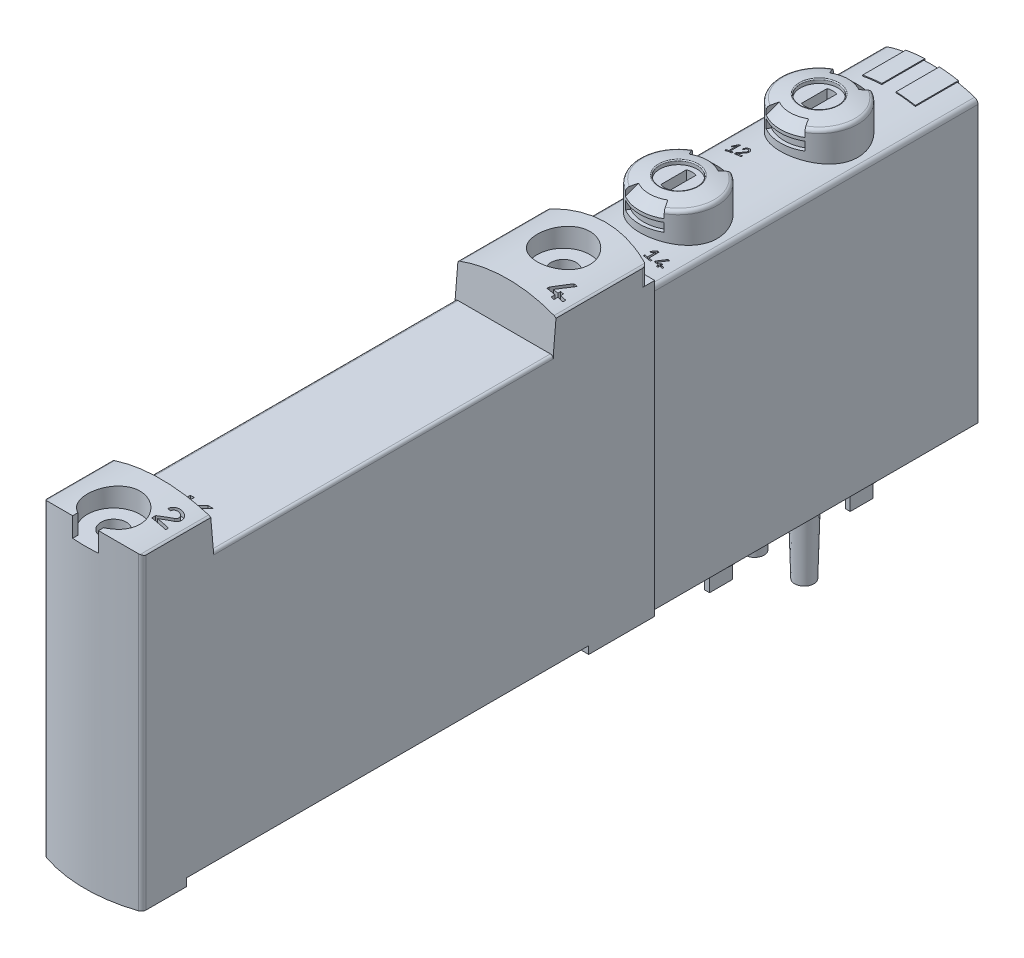
from build123d import *

# Parameters (mm, degrees)
BOSS_EXTRUDE1_DEPTH          = 34
CUT_EXTRUDE1_DEPTH           = 6
CUT_EXTRUDE1_DEPTH_BACK      = 6
SKETCH2_W                    = 34.1
SKETCH2_H                    = 0.4
CUT_EXTRUDE2_DEPTH           = 1.9
CUT_EXTRUDE3_DEPTH           = 1.9
SKETCH9_W                    = 0.5
SKETCH9_H                    = 2.4
BOSS_EXTRUDE2_DEPTH          = 2.5
SKETCH10_W                   = 0.5
SKETCH10_H                   = 2.4
BOSS_EXTRUDE3_DEPTH          = 2.5
SKETCH11_W                   = 0.5
SKETCH11_H                   = 2.4
BOSS_EXTRUDE4_DEPTH          = 2.5
SKETCH12_W                   = 0.5
SKETCH12_H                   = 2.4
BOSS_EXTRUDE5_DEPTH          = 2.5
CUT_REVOLVE1_ANGLE           = 30
CUT_REVOLVE1_OTHER_WAY_ANGLE = 30
CUT_REVOLVE2_ANGLE           = 30
CUT_REVOLVE2_OTHER_WAY_ANGLE = 30
CUT_EXTRUDE4_DEPTH           = 1.7
CUT_REVOLVE3_ANGLE           = 30
CUT_REVOLVE3_OTHER_WAY_ANGLE = 30
CUT_REVOLVE4_ANGLE           = 30
CUT_REVOLVE4_OTHER_WAY_ANGLE = 30
CUT_EXTRUDE5_DEPTH           = 1.7
BOSS_EXTRUDE6_DEPTH          = 4.5
BOSS_EXTRUDE7_DEPTH          = 4.5
BOSS_EXTRUDE8_DEPTH          = 33.1
CUT_EXTRUDE6_DEPTH           = 10
CUT_EXTRUDE6_DEPTH_BACK      = 10
CUT_EXTRUDE7_DEPTH           = 10
CUT_EXTRUDE8_DEPTH           = 10
CUT_EXTRUDE8_DEPTH_BACK      = 10
SKETCH26_W                   = 42
SKETCH26_H                   = 1
CUT_EXTRUDE9_DEPTH           = 55
CUT_EXTRUDE10_DEPTH          = 35.5
CUT_EXTRUDE11_DEPTH          = 2.1
CUT_EXTRUDE11_DEPTH_BACK     = 2.1
SKETCH30_W                   = 1.325
SKETCH30_H                   = 31
CUT_EXTRUDE12_DEPTH          = 3.5
CUT_EXTRUDE12_DEPTH_BACK     = 3.5
CUT_EXTRUDE13_DEPTH          = 3.5
CUT_EXTRUDE13_DEPTH_BACK     = 3.5
CUT_EXTRUDE14_DEPTH          = 3.5
CUT_EXTRUDE14_DEPTH_BACK     = 3.5
CUT_EXTRUDE15_DEPTH          = 3.5
CUT_EXTRUDE15_DEPTH_BACK     = 3.5
CUT_EXTRUDE16_DEPTH          = 1
CUT_EXTRUDE16_DEPTH_BACK     = 1
CUT_EXTRUDE17_DEPTH          = 1
CUT_EXTRUDE17_DEPTH_BACK     = 1
CUT_EXTRUDE18_DEPTH          = 4.5
CUT_EXTRUDE18_DEPTH_BACK     = 4.5


with BuildPart() as part:
    # Sketch1 → Boss-Extrude1 (new body)
    with BuildSketch(Plane.XY.offset(-23.2)):
        with BuildLine():
            Line((-4.9, 29.216294728), (-4.9, 0))
            Line((-4.9, 0), (4.9, 0))
            Line((4.9, 0), (4.9, 29.216294728))
            ThreePointArc((4.9, 29.216294728), (4.803647166, 29.511369236), (4.551724138, 29.692718684))
            ThreePointArc((4.551724138, 29.692718684), (0, 30.4), (-4.551724138, 29.692718684))
            ThreePointArc((-4.551724138, 29.692718684), (-4.803647166, 29.511369236), (-4.9, 29.216294728))
        make_face()
    extrude(amount=BOSS_EXTRUDE1_DEPTH)

    # Sketch2 → Cut-Extrude1 (cut, two sides: drawn at the far end of the back side and taken through both)
    with BuildSketch(Plane(origin=(0, 0, 0), x_dir=(0, 0, -1), z_dir=(1, 0, 0)).offset(-CUT_EXTRUDE1_DEPTH_BACK)):
        with Locations((6.17, 0.2)):
            Rectangle(SKETCH2_W, SKETCH2_H)
    extrude(amount=CUT_EXTRUDE1_DEPTH + CUT_EXTRUDE1_DEPTH_BACK, mode=Mode.SUBTRACT)

    # Sketch3 → Cut-Extrude2 (cut)
    with BuildSketch(Plane(origin=(0, 0, 0), x_dir=(1, 0, 0), z_dir=(0, 1, 0))):
        with BuildLine():
            Line((-3.15, 2.465258607), (-3.15, -2.465258607))
            ThreePointArc((-3.15, -2.465258607), (0, -4), (3.15, -2.465258607))
            Line((3.15, -2.465258607), (3.15, 2.465258607))
            ThreePointArc((3.15, 2.465258607), (0, 4), (-3.15, 2.465258607))
        make_face()
    extrude(amount=CUT_EXTRUDE2_DEPTH, mode=Mode.SUBTRACT)

    # Sketch4 → Cut-Extrude3 (cut)
    with BuildSketch(Plane(origin=(0, 0, 0), x_dir=(1, 0, 0), z_dir=(0, 1, 0))):
        with BuildLine():
            Line((-3.15, 17.165258607), (-3.15, 12.234741393))
            ThreePointArc((-3.15, 12.234741393), (0, 10.7), (3.15, 12.234741393))
            Line((3.15, 12.234741393), (3.15, 17.165258607))
            ThreePointArc((3.15, 17.165258607), (0, 18.7), (-3.15, 17.165258607))
        make_face()
    extrude(amount=CUT_EXTRUDE3_DEPTH, mode=Mode.SUBTRACT)

    # Sketch5 → Revolve1 (revolve)
    with BuildSketch(Plane(origin=(0, 0, 0), x_dir=(0, 0, -1), z_dir=(1, 0, 0))):
        Polygon((0, 2.1), (3.05, 2.1), (3.05, 1.1), (2.25, 1.1), (2.25, -1.4), (2.65, -1.4), (2.65, -1.72), (2.430606898, -2.1), (0, -2.1), align=None)
    revolve(axis=Axis((0, -2.1, 0), (0, 1, 0)))

    # Sketch6 → Revolve2 (revolve)
    with BuildSketch(Plane(origin=(0, 0, 0), x_dir=(0, 0, -1), z_dir=(1, 0, 0))):
        Polygon((14.7, 2.1), (17.75, 2.1), (17.75, 1.1), (16.95, 1.1), (16.95, -1.4), (17.35, -1.4), (17.35, -1.72), (17.130606898, -2.1), (14.7, -2.1), align=None)
    revolve(axis=Axis((0, -2.1, -14.7), (0, 1, 0)))

    # Sketch7 → Revolve3 (revolve)
    with BuildSketch(Plane.XY.offset(-7.35)):
        with BuildLine():
            Line((2.6, 0.4), (3.8, 0.4))
            Line((3.8, 0.4), (3.6, -6.9))
            ThreePointArc((3.6, -6.9), (3.106540729, -7.021444616), (2.6, -7.06227766))
            Line((2.6, -7.06227766), (2.6, 0.4))
        make_face()
    revolve(axis=Axis((2.6, -7.06227766, -7.35), (0, 1, 0)))

    # Sketch8 → Revolve4 (revolve)
    with BuildSketch(Plane.XY.offset(-7.35)):
        with BuildLine():
            Line((-2.6, 0.4), (-1.4, 0.4))
            Line((-1.4, 0.4), (-1.6, -6.9))
            ThreePointArc((-1.6, -6.9), (-2.093459271, -7.021444616), (-2.6, -7.06227766))
            Line((-2.6, -7.06227766), (-2.6, 0.4))
        make_face()
    revolve(axis=Axis((-2.6, -7.06227766, -7.35), (0, 1, 0)))

    # Sketch9 → Boss-Extrude2 (add)
    with BuildSketch(Plane(origin=(0, -2.1, 0), x_dir=(-1, 0, 0), z_dir=(0, -1, 0))):
        with Locations((-1, 0)):
            Rectangle(SKETCH9_W, SKETCH9_H)
    extrude(amount=BOSS_EXTRUDE2_DEPTH)

    # Sketch10 → Boss-Extrude3 (add)
    with BuildSketch(Plane(origin=(0, -2.1, 0), x_dir=(-1, 0, 0), z_dir=(0, -1, 0))):
        with Locations((1, 0)):
            Rectangle(SKETCH10_W, SKETCH10_H)
    extrude(amount=BOSS_EXTRUDE3_DEPTH)

    # Sketch11 → Boss-Extrude4 (add)
    with BuildSketch(Plane(origin=(0, -2.1, 0), x_dir=(-1, 0, 0), z_dir=(0, -1, 0))):
        with Locations((-1, 14.7)):
            Rectangle(SKETCH11_W, SKETCH11_H)
    extrude(amount=BOSS_EXTRUDE4_DEPTH)

    # Sketch12 → Boss-Extrude5 (add)
    with BuildSketch(Plane(origin=(0, -2.1, 0), x_dir=(-1, 0, 0), z_dir=(0, -1, 0))):
        with Locations((1, 14.7)):
            Rectangle(SKETCH12_W, SKETCH12_H)
    extrude(amount=BOSS_EXTRUDE5_DEPTH)

    # Sketch13 → Revolve5 (revolve)
    with BuildSketch(Plane(origin=(0, 0, 0), x_dir=(0, 0, -1), z_dir=(1, 0, 0))):
        with BuildLine():
            Line((-3.2, 33.13), (-1.25, 33.13))
            Line((-1.25, 33.13), (-1.25, 33.458302748))
            ThreePointArc((-1.25, 33.458302748), (-1.215666434, 33.533721045), (-1.136241611, 33.55735176))
            ThreePointArc((-1.136241611, 33.55735176), (-0.28833743, 33.414694053), (0.549999769, 33.223687608))
            ThreePointArc((0.549999769, 33.223687608), (0.766227693, 33.081338282), (0.85, 32.836389214))
            Line((0.85, 32.836389214), (0.85, 28.4))
            Line((0.85, 28.4), (-3.2, 28.4))
            Line((-3.2, 28.4), (-3.2, 33.13))
        make_face()
    revolve(axis=Axis((0, 28.4, 3.2), (0, 1, 0)))

    # Sketch14 → Revolve6 (revolve)
    with BuildSketch(Plane(origin=(0, 0, 0), x_dir=(0, 0, -1), z_dir=(1, 0, 0))):
        with BuildLine():
            Line((11.5, 33.13), (13.45, 33.13))
            Line((13.45, 33.13), (13.45, 33.458302748))
            ThreePointArc((13.45, 33.458302748), (13.484333566, 33.533721045), (13.563758389, 33.55735176))
            ThreePointArc((13.563758389, 33.55735176), (14.411662804, 33.414694007), (15.250000231, 33.223687489))
            ThreePointArc((15.250000231, 33.223687489), (15.466227839, 33.081338094), (15.55, 32.836389214))
            Line((15.55, 32.836389214), (15.55, 28.4))
            Line((15.55, 28.4), (11.5, 28.4))
            Line((11.5, 28.4), (11.5, 33.13))
        make_face()
    revolve(axis=Axis((0, 28.4, -11.5), (0, 1, 0)))

    # Sketch15 → Cut-Revolve1 (revolve, cut)
    with BuildSketch(Plane(origin=(0, 0, 0), x_dir=(0, 0, -1), z_dir=(1, 0, 0))):
        Polygon((-0.47, 33.7), (0.9, 32.33), (0.9, 32.05), (0.45, 32.05), (0.45, 31.15), (0.9, 31.15), (0.9, 30.5), (1.3, 30.5), (1.3, 33.7), align=None)
    revolve(axis=Axis((0, 30.5, 3.2), (0, -1, 0)), revolution_arc=CUT_REVOLVE1_ANGLE, mode=Mode.SUBTRACT)

    # Sketch15 → Cut-Revolve1 other way (revolve, cut)
    with BuildSketch(Plane(origin=(0, 0, 0), x_dir=(0, 0, -1), z_dir=(1, 0, 0))):
        Polygon((-0.47, 33.7), (0.9, 32.33), (0.9, 32.05), (0.45, 32.05), (0.45, 31.15), (0.9, 31.15), (0.9, 30.5), (1.3, 30.5), (1.3, 33.7), align=None)
    revolve(axis=Axis((0, 30.5, 3.2), (0, 1, 0)), revolution_arc=CUT_REVOLVE1_OTHER_WAY_ANGLE, mode=Mode.SUBTRACT)

    # Sketch16 → Cut-Revolve2 (revolve, cut)
    with BuildSketch(Plane(origin=(0, 0, 0), x_dir=(0, 0, -1), z_dir=(1, 0, 0))):
        Polygon((-7.7, 30.5), (-7.3, 30.5), (-7.3, 31.15), (-6.85, 31.15), (-6.85, 32.05), (-7.3, 32.05), (-7.3, 32.33), (-5.93, 33.7), (-7.7, 33.7), align=None)
    revolve(axis=Axis((0, 33.7, 3.2), (0, 1, 0)), revolution_arc=CUT_REVOLVE2_ANGLE, mode=Mode.SUBTRACT)

    # Sketch16 → Cut-Revolve2 other way (revolve, cut)
    with BuildSketch(Plane(origin=(0, 0, 0), x_dir=(0, 0, -1), z_dir=(1, 0, 0))):
        Polygon((-7.7, 30.5), (-7.3, 30.5), (-7.3, 31.15), (-6.85, 31.15), (-6.85, 32.05), (-7.3, 32.05), (-7.3, 32.33), (-5.93, 33.7), (-7.7, 33.7), align=None)
    revolve(axis=Axis((0, 33.7, 3.2), (0, -1, 0)), revolution_arc=CUT_REVOLVE2_OTHER_WAY_ANGLE, mode=Mode.SUBTRACT)

    # Sketch17 → Cut-Extrude4 (cut)
    with BuildSketch(Plane(origin=(0, 33.13, 0), x_dir=(1, 0, 0), z_dir=(0, 1, 0))):
        with BuildLine():
            Line((0.5, -4.534400615), (0.5, -1.865599385))
            ThreePointArc((0.5, -1.865599385), (0, -1.775), (-0.5, -1.865599385))
            Line((-0.5, -1.865599385), (-0.5, -4.534400615))
            ThreePointArc((-0.5, -4.534400615), (0, -4.625), (0.5, -4.534400615))
        make_face()
    extrude(amount=-CUT_EXTRUDE4_DEPTH, mode=Mode.SUBTRACT)

    # Sketch18 → Cut-Revolve3 (revolve, cut)
    with BuildSketch(Plane(origin=(0, 0, 0), x_dir=(0, 0, -1), z_dir=(1, 0, 0))):
        Polygon((14.23, 33.7), (15.6, 32.33), (15.6, 32.05), (15.15, 32.05), (15.15, 31.15), (15.6, 31.15), (15.6, 30.5), (16, 30.5), (16, 33.7), align=None)
    revolve(axis=Axis((0, 30.5, -11.5), (0, -1, 0)), revolution_arc=CUT_REVOLVE3_ANGLE, mode=Mode.SUBTRACT)

    # Sketch18 → Cut-Revolve3 other way (revolve, cut)
    with BuildSketch(Plane(origin=(0, 0, 0), x_dir=(0, 0, -1), z_dir=(1, 0, 0))):
        Polygon((14.23, 33.7), (15.6, 32.33), (15.6, 32.05), (15.15, 32.05), (15.15, 31.15), (15.6, 31.15), (15.6, 30.5), (16, 30.5), (16, 33.7), align=None)
    revolve(axis=Axis((0, 30.5, -11.5), (0, 1, 0)), revolution_arc=CUT_REVOLVE3_OTHER_WAY_ANGLE, mode=Mode.SUBTRACT)

    # Sketch19 → Cut-Revolve4 (revolve, cut)
    with BuildSketch(Plane(origin=(0, 0, 0), x_dir=(0, 0, -1), z_dir=(1, 0, 0))):
        Polygon((7, 30.5), (7.4, 30.5), (7.4, 31.15), (7.85, 31.15), (7.85, 32.05), (7.4, 32.05), (7.4, 32.33), (8.77, 33.7), (7, 33.7), align=None)
    revolve(axis=Axis((0, 33.7, -11.5), (0, 1, 0)), revolution_arc=CUT_REVOLVE4_ANGLE, mode=Mode.SUBTRACT)

    # Sketch19 → Cut-Revolve4 other way (revolve, cut)
    with BuildSketch(Plane(origin=(0, 0, 0), x_dir=(0, 0, -1), z_dir=(1, 0, 0))):
        Polygon((7, 30.5), (7.4, 30.5), (7.4, 31.15), (7.85, 31.15), (7.85, 32.05), (7.4, 32.05), (7.4, 32.33), (8.77, 33.7), (7, 33.7), align=None)
    revolve(axis=Axis((0, 33.7, -11.5), (0, -1, 0)), revolution_arc=CUT_REVOLVE4_OTHER_WAY_ANGLE, mode=Mode.SUBTRACT)

    # Sketch20 → Cut-Extrude5 (cut)
    with BuildSketch(Plane(origin=(0, 33.13, 0), x_dir=(1, 0, 0), z_dir=(0, 1, 0))):
        with BuildLine():
            Line((0.5, 10.165599385), (0.5, 12.834400615))
            ThreePointArc((0.5, 12.834400615), (0, 12.925), (-0.5, 12.834400615))
            Line((-0.5, 12.834400615), (-0.5, 10.165599385))
            ThreePointArc((-0.5, 10.165599385), (0, 10.075), (0.5, 10.165599385))
        make_face()
    extrude(amount=-CUT_EXTRUDE5_DEPTH, mode=Mode.SUBTRACT)

    # Sketch21 → Boss-Extrude6 (add)
    with BuildSketch(Plane.XY.offset(-23.3)):
        with BuildLine():
            Line((0.75, 30.481362671), (0.75, 27))
            Line((0.75, 27), (2.75, 27))
            Line((2.75, 27), (2.75, 30.247474533))
            ThreePointArc((2.75, 30.247474533), (1.753903052, 30.397793974), (0.75, 30.481362671))
        make_face()
    extrude(amount=BOSS_EXTRUDE6_DEPTH)

    # Sketch22 → Boss-Extrude7 (add)
    with BuildSketch(Plane.XY.offset(-23.3)):
        with BuildLine():
            Line((-2.75, 30.247474533), (-2.75, 27))
            Line((-2.75, 27), (-0.75, 27))
            Line((-0.75, 27), (-0.75, 30.481362671))
            ThreePointArc((-0.75, 30.481362671), (-1.753903052, 30.397793974), (-2.75, 30.247474533))
        make_face()
    extrude(amount=BOSS_EXTRUDE7_DEPTH)

    # Sketch23 → Boss-Extrude8 (add)
    with BuildSketch(Plane(origin=(0, 0, 0), x_dir=(1, 0, 0), z_dir=(0, 1, 0))):
        with BuildLine():
            Line((5.125, -63.942611651), (5.125, -10.8))
            Line((5.125, -10.8), (-5.125, -10.8))
            Line((-5.125, -10.8), (-5.125, -63.942611651))
            ThreePointArc((-5.125, -63.942611651), (-5.031042719, -64.234380927), (-4.784482759, -64.416494812))
            ThreePointArc((-4.784482759, -64.416494812), (0, -65.2), (4.784482759, -64.416494812))
            ThreePointArc((4.784482759, -64.416494812), (5.031042719, -64.234380927), (5.125, -63.942611651))
        make_face()
    extrude(amount=BOSS_EXTRUDE8_DEPTH)

    # Sketch24 → Cut-Extrude6 (cut, two sides: drawn at the far end of the back side and taken through both)
    with BuildSketch(Plane(origin=(0, 0, 0), x_dir=(0, 0, -1), z_dir=(1, 0, 0)).offset(-CUT_EXTRUDE6_DEPTH_BACK)):
        Polygon((-57.774886635, 38.9), (-56.9, 28.9), (-21.4, 28.9), (-20.525113365, 38.9), align=None)
    extrude(amount=CUT_EXTRUDE6_DEPTH + CUT_EXTRUDE6_DEPTH_BACK, mode=Mode.SUBTRACT)

    # Sketch25 → Cut-Extrude7 (cut)
    with BuildSketch(Plane(origin=(0, 30.4, 0), x_dir=(1, 0, 0), z_dir=(0, 1, 0))):
        with BuildLine():
            Line((-5.125, -8.8), (-5.125, -12.057388349))
            ThreePointArc((-5.125, -12.057388349), (-5.031042719, -11.765619073), (-4.784482759, -11.583505188))
            ThreePointArc((-4.784482759, -11.583505188), (0, -10.8), (4.784482759, -11.583505188))
            ThreePointArc((4.784482759, -11.583505188), (5.031042719, -11.765619073), (5.125, -12.057388349))
            Line((5.125, -12.057388349), (5.125, -8.8))
            Line((5.125, -8.8), (-5.125, -8.8))
        make_face()
    extrude(amount=CUT_EXTRUDE7_DEPTH, mode=Mode.SUBTRACT)

    # Sketch26 → Cut-Extrude8 (cut, two sides: drawn at the far end of the back side and taken through both)
    with BuildSketch(Plane(origin=(0, 0, 0), x_dir=(0, 0, -1), z_dir=(1, 0, 0)).offset(-CUT_EXTRUDE8_DEPTH_BACK)):
        with Locations((-38.7, 0.3)):
            Rectangle(SKETCH26_W, SKETCH26_H)
    extrude(amount=CUT_EXTRUDE8_DEPTH + CUT_EXTRUDE8_DEPTH_BACK, mode=Mode.SUBTRACT)

    # Sketch27 → Cut-Extrude9 (cut)
    with BuildSketch(Plane.XY.offset(10.8)):
        with BuildLine():
            Line((-5.25, 35.1), (-5.25, 31.799908759))
            ThreePointArc((-5.25, 31.799908759), (-5.157367495, 32.089825513), (-4.913793103, 32.272319406))
            ThreePointArc((-4.913793103, 32.272319406), (0, 33.1), (4.913793103, 32.272319406))
            ThreePointArc((4.913793103, 32.272319406), (5.157367495, 32.089825513), (5.25, 31.799908759))
            Line((5.25, 31.799908759), (5.25, 35.1))
            Line((5.25, 35.1), (-5.25, 35.1))
        make_face()
    extrude(amount=CUT_EXTRUDE9_DEPTH, mode=Mode.SUBTRACT)

    # Sketch28 → Cut-Extrude10 (cut)
    with BuildSketch(Plane.XY.offset(21.4)):
        with BuildLine():
            Line((-4.825, 28.9), (4.825, 28.9))
            ThreePointArc((4.825, 28.9), (5.037132034, 28.812132034), (5.125, 28.6))
            Line((5.125, 28.6), (5.125, 33.6))
            Line((5.125, 33.6), (-5.125, 33.6))
            Line((-5.125, 33.6), (-5.125, 28.6))
            ThreePointArc((-5.125, 28.6), (-5.037132034, 28.812132034), (-4.825, 28.9))
        make_face()
    extrude(amount=CUT_EXTRUDE10_DEPTH, mode=Mode.SUBTRACT)

    # Sketch29 → Cut-Extrude11 (cut, two sides: drawn at the far end of the back side and taken through both)
    with BuildSketch(Plane(origin=(0, 33.1, 0), x_dir=(1, 0, 0), z_dir=(0, 1, 0)).offset(-CUT_EXTRUDE11_DEPTH_BACK)):
        with BuildLine():
            Line((-1.35, -64.59582971), (-1.35, -66))
            Line((-1.35, -66), (1.35, -66))
            Line((1.35, -66), (1.35, -64.59582971))
            ThreePointArc((1.35, -64.59582971), (0, -59.45), (-1.35, -64.59582971))
        make_face()
    extrude(amount=CUT_EXTRUDE11_DEPTH + CUT_EXTRUDE11_DEPTH_BACK, mode=Mode.SUBTRACT)

    # Sketch30 → Cut-Revolve5 (revolve, cut)
    with BuildSketch(Plane(origin=(0, 0, 0), x_dir=(0, 0, -1), z_dir=(1, 0, 0))):
        with Locations((-61.5375, 15.5)):
            Rectangle(SKETCH30_W, SKETCH30_H)
    revolve(axis=Axis((0, 0, 62.2), (0, 1, 0)), mode=Mode.SUBTRACT)

    # Sketch31 → Cut-Revolve6 (revolve, cut)
    with BuildSketch(Plane(origin=(0, 0, 0), x_dir=(0, 0, -1), z_dir=(1, 0, 0))):
        Polygon((-15.2, 33.2), (-12.45, 33.2), (-12.45, 31), (-13.875, 31), (-13.875, 0), (-15.2, 0), align=None)
    revolve(axis=Axis((0, 0, 15.2), (0, 1, 0)), mode=Mode.SUBTRACT)

    # Sketch32 → Cut-Revolve7 (revolve, cut)
    with BuildSketch(Plane(origin=(0, 0, 0), x_dir=(0, 0, -1), z_dir=(1, 0, 0))):
        Polygon((-40.2, 9.8), (-38.1, 9.8), (-38.1, 1.8), (-37.4, 1.8), (-37.4, 0.8), (-40.2, 0.8), align=None)
    revolve(axis=Axis((0, 0.8, 40.2), (0, 1, 0)), mode=Mode.SUBTRACT)

    # Sketch33 → Cut-Revolve8 (revolve, cut)
    with BuildSketch(Plane(origin=(-1.55, 0, 0), x_dir=(0, 0, -1), z_dir=(1, 0, 0))):
        Polygon((-29.1, 9.8), (-27, 9.8), (-27, 1.8), (-26.3, 1.8), (-26.3, 0.8), (-29.1, 0.8), align=None)
    revolve(axis=Axis((-1.55, 0.8, 29.1), (0, 1, 0)), mode=Mode.SUBTRACT)

    # Sketch34 → Cut-Revolve9 (revolve, cut)
    with BuildSketch(Plane(origin=(-1.55, 0, 0), x_dir=(0, 0, -1), z_dir=(1, 0, 0))):
        Polygon((-46.1, 9.8), (-44, 9.8), (-44, 1.8), (-43.3, 1.8), (-43.3, 0.8), (-46.1, 0.8), align=None)
    revolve(axis=Axis((-1.55, 0.8, 46.1), (0, 1, 0)), mode=Mode.SUBTRACT)

    # Sketch35 → Cut-Revolve10 (revolve, cut)
    with BuildSketch(Plane(origin=(1.55, 0, 0), x_dir=(0, 0, -1), z_dir=(1, 0, 0))):
        Polygon((-34.3, 9.8), (-32.2, 9.8), (-32.2, 1.8), (-31.5, 1.8), (-31.5, 0.8), (-34.3, 0.8), align=None)
    revolve(axis=Axis((1.55, 0.8, 34.3), (0, 1, 0)), mode=Mode.SUBTRACT)

    # Sketch36 → Cut-Revolve11 (revolve, cut)
    with BuildSketch(Plane(origin=(1.55, 0, 0), x_dir=(0, 0, -1), z_dir=(1, 0, 0))):
        Polygon((-51.3, 9.8), (-49.2, 9.8), (-49.2, 1.8), (-48.5, 1.8), (-48.5, 0.8), (-51.3, 0.8), align=None)
    revolve(axis=Axis((1.55, 0.8, 51.3), (0, 1, 0)), mode=Mode.SUBTRACT)

    # Sketch37 → Cut-Extrude12 (cut, two sides: drawn at the far end of the back side and taken through both)
    with BuildSketch(Plane(origin=(0, 33.1, 0), x_dir=(1, 0, 0), z_dir=(0, 1, 0)).offset(-CUT_EXTRUDE12_DEPTH_BACK)):
        Polygon((-3.398476194, 5.738028118), (-3.297824684, 5.667551171), (-3.075, 5.985777799), (-3.075, 5.15), (-3.375, 5.15), (-3.375, 5), (-2.625, 5), (-2.625, 5.15), (-2.925, 5.15), (-2.925, 6.2), (-3.075, 6.2), align=None)
    extrude(amount=CUT_EXTRUDE12_DEPTH + CUT_EXTRUDE12_DEPTH_BACK, mode=Mode.SUBTRACT)

    # Sketch38 → Cut-Extrude13 (cut, two sides: drawn at the far end of the back side and taken through both)
    with BuildSketch(Plane(origin=(0, 33.1, 0), x_dir=(1, 0, 0), z_dir=(0, 1, 0)).offset(-CUT_EXTRUDE13_DEPTH_BACK)):
        with BuildLine():
            Line((-2.3625, 5.8375), (-2.2125, 5.8375))
            ThreePointArc((-2.2125, 5.8375), (-1.915590111, 6.03251595), (-1.854559099, 5.682570356))
            Line((-1.854559099, 5.682570356), (-2.3625, 5.205738549))
            Line((-2.3625, 5.205738549), (-2.3625, 5))
            Line((-2.3625, 5), (-1.6375, 5))
            Line((-1.6375, 5), (-1.6375, 5.15))
            Line((-1.6375, 5.15), (-2.202713816, 5.15))
            Line((-2.202713816, 5.15), (-1.751894934, 5.573208255))
            ThreePointArc((-1.751894934, 5.573208255), (-1.85600666, 6.170174267), (-2.3625, 5.8375))
        make_face()
    extrude(amount=CUT_EXTRUDE13_DEPTH + CUT_EXTRUDE13_DEPTH_BACK, mode=Mode.SUBTRACT)

    # Sketch39 → Cut-Extrude14 (cut, two sides: drawn at the far end of the back side and taken through both)
    with BuildSketch(Plane(origin=(0, 33.1, 0), x_dir=(1, 0, 0), z_dir=(0, 1, 0)).offset(-CUT_EXTRUDE14_DEPTH_BACK)):
        Polygon((2.101523806, -8.261971882), (2.202175316, -8.332448829), (2.425, -8.014222201), (2.425, -8.85), (2.125, -8.85), (2.125, -9), (2.875, -9), (2.875, -8.85), (2.575, -8.85), (2.575, -7.8), (2.425, -7.8), align=None)
    extrude(amount=CUT_EXTRUDE14_DEPTH + CUT_EXTRUDE14_DEPTH_BACK, mode=Mode.SUBTRACT)

    # Sketch40 → Cut-Extrude15 (cut, two sides: drawn at the far end of the back side and taken through both)
    with BuildSketch(Plane(origin=(0, 33.1, 0), x_dir=(1, 0, 0), z_dir=(0, 1, 0)).offset(-CUT_EXTRUDE15_DEPTH_BACK)):
        Polygon((3.085, -8.8), (3.5, -8.8), (3.5, -9), (3.65, -9), (3.65, -8.8), (3.915, -8.8), (3.915, -8.65), (3.65, -8.65), (3.65, -8.5), (3.5, -8.5), (3.5, -8.65), (3.269946149, -8.65), (3.666307658, -7.8), (3.50080097, -7.8), (3.085, -8.691688058), align=None)
    extrude(amount=CUT_EXTRUDE15_DEPTH + CUT_EXTRUDE15_DEPTH_BACK, mode=Mode.SUBTRACT)

    # Sketch41 → Cut-Extrude16 (cut, two sides: drawn at the far end of the back side and taken through both)
    with BuildSketch(Plane(origin=(0, 33.1, 0), x_dir=(1, 0, 0), z_dir=(0, 1, 0)).offset(-CUT_EXTRUDE16_DEPTH_BACK)):
        Polygon((2.67, -19.6), (3.5, -19.6), (3.5, -20), (3.8, -20), (3.8, -19.6), (4.33, -19.6), (4.33, -19.3), (3.8, -19.3), (3.8, -19), (3.5, -19), (3.5, -19.3), (3.039892297, -19.3), (3.832615316, -17.6), (3.501601941, -17.6), (2.67, -19.383376117), align=None)
    extrude(amount=CUT_EXTRUDE16_DEPTH + CUT_EXTRUDE16_DEPTH_BACK, mode=Mode.SUBTRACT)

    # Sketch42 → Cut-Extrude17 (cut, two sides: drawn at the far end of the back side and taken through both)
    with BuildSketch(Plane(origin=(0, 33.1, 0), x_dir=(1, 0, 0), z_dir=(0, 1, 0)).offset(-CUT_EXTRUDE17_DEPTH_BACK)):
        with BuildLine():
            Line((2.775, -59.325), (3.075, -59.325))
            ThreePointArc((3.075, -59.325), (3.668819777, -58.9349681), (3.790881801, -59.634859287))
            Line((3.790881801, -59.634859287), (2.775, -60.588522903))
            Line((2.775, -60.588522903), (2.775, -61))
            Line((2.775, -61), (4.225, -61))
            Line((4.225, -61), (4.225, -60.7))
            Line((4.225, -60.7), (3.094572368, -60.7))
            Line((3.094572368, -60.7), (3.996210131, -59.85358349))
            ThreePointArc((3.996210131, -59.85358349), (3.787986679, -58.659651465), (2.775, -59.325))
        make_face()
    extrude(amount=CUT_EXTRUDE17_DEPTH + CUT_EXTRUDE17_DEPTH_BACK, mode=Mode.SUBTRACT)

    # Sketch43 → Cut-Extrude18 (cut, two sides: drawn at the far end of the back side and taken through both)
    with BuildSketch(Plane(origin=(0, 33.1, 0), x_dir=(1, 0, 0), z_dir=(0, 1, 0)).offset(-CUT_EXTRUDE18_DEPTH_BACK)):
        Polygon((-1.2, -53), (-1.2, -56), (-0.78, -56), (-0.78, -54.95), (-0.327272727, -54.504132231), (0.66, -56), (1.2, -56), (0, -54.181818182), (1.2, -53), (0.66, -53), (-0.78, -54.418181818), (-0.78, -53), align=None)
    extrude(amount=CUT_EXTRUDE18_DEPTH + CUT_EXTRUDE18_DEPTH_BACK, mode=Mode.SUBTRACT)


solid = part.part
